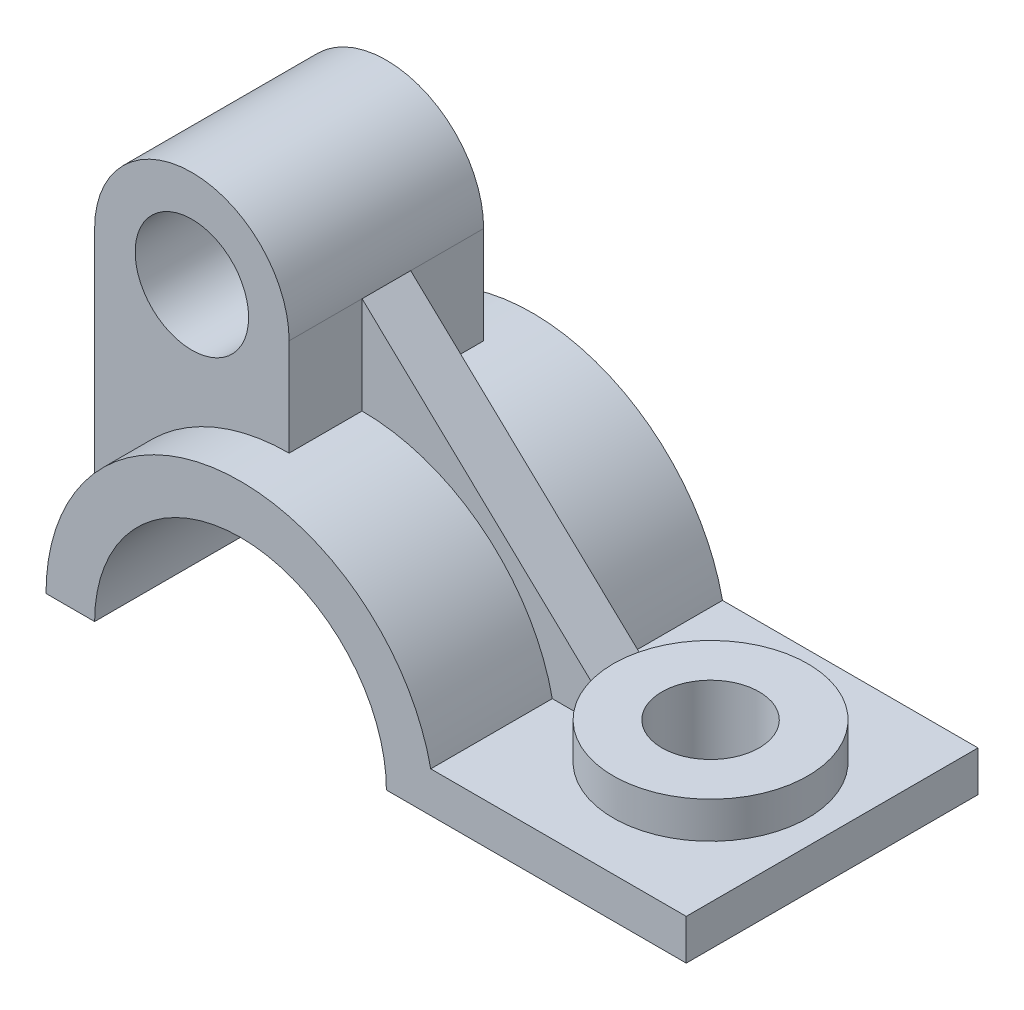
from build123d import *

# Parameters (mm, degrees)
BOSS_EXTRUDE1_DEPTH    = 18
SKETCH1_3_R            = 7
BOSS_EXTRUDE2_DEPTH    = 12
SKETCH2_R              = 12
BOSS_EXTRUDE3_DEPTH    = 4.5
RIB1_REACH             = 77.186
SKETCH3_WALL_W         = 190.924782946
SKETCH3_WALL_H         = 6
F_12_0MM_DOWEL_HOLE1_D = 12


with BuildPart() as part:
    # Sketch1 → Boss-Extrude1 (new, symmetric)
    with BuildSketch(Plane.XY):
        with BuildLine():
            Line((-24, 0), (-18, 0))
            ThreePointArc((-18, 0), (0, 18), (18, 0))
            Line((18, 0), (55, 0))
            Line((55, 0), (55, 5))
            Line((55, 5), (23.473389189, 5))
            ThreePointArc((23.473389189, 5), (-2.513827706, 23.86798421), (-24, 0))
        make_face()
    extrude(amount=BOSS_EXTRUDE1_DEPTH, both=True)

    # Sketch1<3> → Boss-Extrude2 (add, symmetric)
    with BuildSketch(Plane.XY):
        with BuildLine():
            Line((-24, 36), (-24, 0))
            ThreePointArc((-24, 0), (-16.970562748, 16.970562748), (0, 24))
            Line((0, 24), (0, 36))
            ThreePointArc((0, 36), (-12, 48), (-24, 36))
        make_face()
        with Locations((-12, 36)):
            Circle(SKETCH1_3_R, mode=Mode.SUBTRACT)
    extrude(amount=BOSS_EXTRUDE2_DEPTH, both=True)

    # Sketch2 → Boss-Extrude3 (add, symmetric)
    with BuildSketch(Plane(origin=(0, 5, 0), x_dir=(1, 0, 0), z_dir=(0, 1, 0))):
        with Locations((40, 0)):
            Circle(SKETCH2_R)
    extrude(amount=BOSS_EXTRUDE3_DEPTH, both=True)

    # Sketch3 wall → Rib1 (add, up to next)
    with BuildSketch(Plane(origin=(14, 22.75, 0), x_dir=(0.72629339981, -0.68738482482, 0), z_dir=(0.68738482482, 0.72629339981, 0)), mode=Mode.PRIVATE) as rib1_sk1:
        Rectangle(SKETCH3_WALL_W, SKETCH3_WALL_H)
    rib1_tool1 = extrude(rib1_sk1.sketch, amount=-RIB1_REACH, mode=Mode.PRIVATE) - part.part
    add(rib1_tool1.solids().sort_by_distance((14, 22.75, 0))[0])

    # Ø12.0mm Dowel Hole1 (through all)
    with Locations(Plane(origin=(0, 9.5, 0), x_dir=(1, 0, 0), z_dir=(0, 1, 0))):
        with Locations((40, 0)):
            Hole(F_12_0MM_DOWEL_HOLE1_D / 2)


solid = part.part
